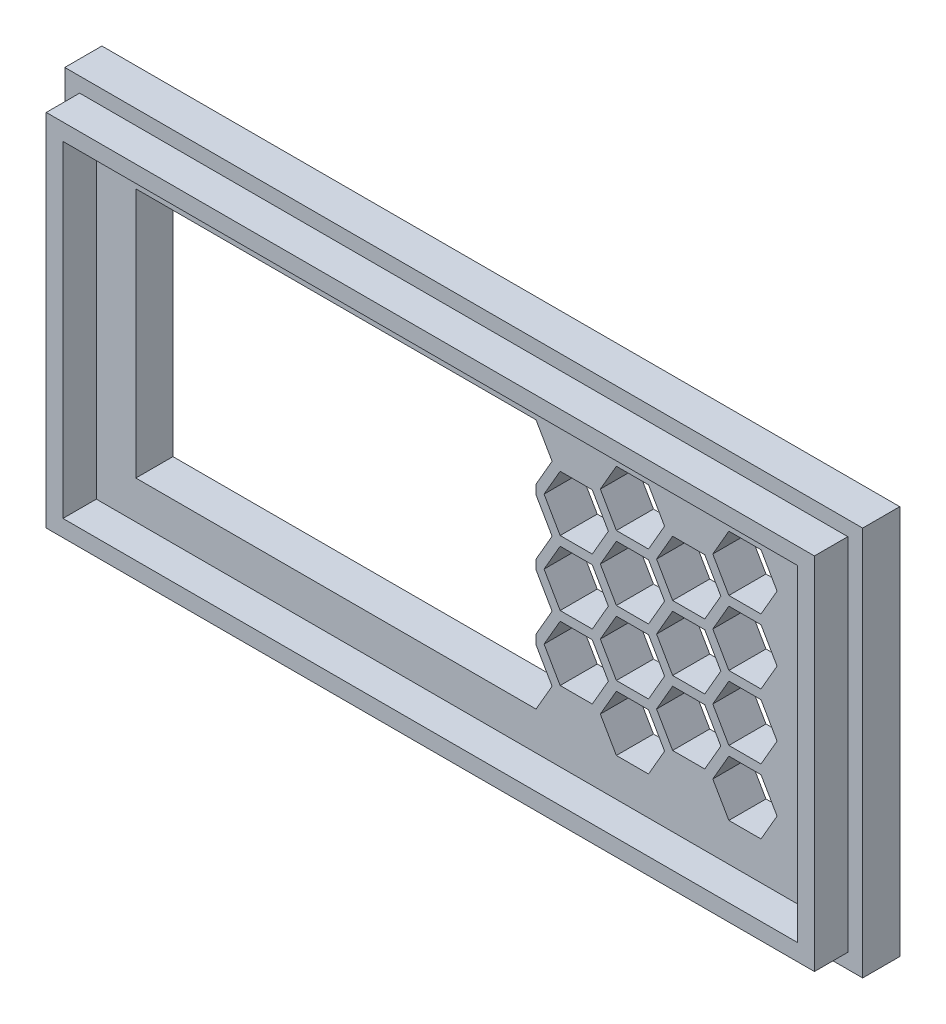
from build123d import *

# Parameters (mm, degrees)
SKETCH1_W           = 43
SKETCH1_H           = 21
BOSS_EXTRUDE1_DEPTH = 2
SKETCH2_W           = 41.4
SKETCH2_H           = 19.4
SKETCH2_W_2         = 39.6
SKETCH2_H_2         = 17.6
BOSS_EXTRUDE2_DEPTH = 1.8
CUT_EXTRUDE1_DEPTH  = 25.010414407
FILL_PATTERN1_DEPTH = 2
SKETCH4_W           = 21.566848352
SKETCH4_H           = 13.5
CUT_EXTRUDE4_DEPTH  = 25.226844615


# Read off the part's stored shape, not the designer's step: Fill Pattern1
with BuildPart() as part:
    # Sketch1 → Boss-Extrude1 (new body)
    with BuildSketch(Plane.XY):
        Rectangle(SKETCH1_W, SKETCH1_H)
    extrude(amount=BOSS_EXTRUDE1_DEPTH)

    # Sketch2 → Boss-Extrude2 (add)
    with BuildSketch(Plane.XY.offset(2)):
        Rectangle(SKETCH2_W, SKETCH2_H)
        Rectangle(SKETCH2_W_2, SKETCH2_H_2, mode=Mode.SUBTRACT)
    extrude(amount=BOSS_EXTRUDE2_DEPTH)

    # Sketch3 → Cut-Extrude1 (cut, through all)
    with BuildSketch(Plane.XY.offset(2)):
        Polygon((-0.866025404, 1.5), (-1.732050808, 0), (-0.866025404, -1.5), (0.866025404, -1.5), (1.732050808, 0), (0.866025404, 1.5), align=None)
    extrude(amount=-CUT_EXTRUDE1_DEPTH, mode=Mode.SUBTRACT)

    # Fill Pattern1 outline → Fill Pattern1 (cut)
    with BuildSketch(Plane.XY):
        Polygon((7.794228634, 0), (6.92820323, 1.5), (5.196152423, 1.5), (4.330127019, 0), (5.196152423, -1.5), (6.92820323, -1.5), align=None)
        Polygon((13.856406461, 0), (12.990381057, 1.5), (11.258330249, 1.5), (10.392304845, 0), (11.258330249, -1.5), (12.990381057, -1.5), align=None)
        Polygon((-4.330127019, 0), (-5.196152423, 1.5), (-6.92820323, 1.5), (-7.794228634, 0), (-6.92820323, -1.5), (-5.196152423, -1.5), align=None)
        Polygon((-10.392304845, 0), (-11.258330249, 1.5), (-12.990381057, 1.5), (-13.856406461, 0), (-12.990381057, -1.5), (-11.258330249, -1.5), align=None)
        Polygon((-2.165063509, 3.75), (-1.299038106, 5.25), (-2.165063509, 6.75), (-3.897114317, 6.75), (-4.763139721, 5.25), (-3.897114317, 3.75), align=None)
        Polygon((3.897114317, -6.75), (4.763139721, -5.25), (3.897114317, -3.75), (2.165063509, -3.75), (1.299038106, -5.25), (2.165063509, -6.75), align=None)
        Polygon((-3.897114317, -6.75), (-2.165063509, -6.75), (-1.299038106, -5.25), (-2.165063509, -3.75), (-3.897114317, -3.75), (-4.763139721, -5.25), align=None)
        Polygon((2.165063509, 3.75), (3.897114317, 3.75), (4.763139721, 5.25), (3.897114317, 6.75), (2.165063509, 6.75), (1.299038106, 5.25), align=None)
        Polygon((16.887495374, -5.25), (16.02146997, -3.75), (14.289419162, -3.75), (13.423393759, -5.25), (14.289419162, -6.75), (16.02146997, -6.75), align=None)
        Polygon((-7.361215932, -5.25), (-8.227241336, -3.75), (-9.959292144, -3.75), (-10.825317547, -5.25), (-9.959292144, -6.75), (-8.227241336, -6.75), align=None)
        Polygon((10.825317547, -5.25), (9.959292144, -3.75), (8.227241336, -3.75), (7.361215932, -5.25), (8.227241336, -6.75), (9.959292144, -6.75), align=None)
        Polygon((-13.423393759, -5.25), (-14.289419162, -3.75), (-16.02146997, -3.75), (-16.887495374, -5.25), (-16.02146997, -6.75), (-14.289419162, -6.75), align=None)
        Polygon((9.959292144, 3.75), (10.825317547, 5.25), (9.959292144, 6.75), (8.227241336, 6.75), (7.361215932, 5.25), (8.227241336, 3.75), align=None)
        Polygon((-10.392304845, 3.5), (-11.258330249, 5), (-12.990381057, 5), (-13.856406461, 3.5), (-12.990381057, 2), (-11.258330249, 2), align=None)
        Polygon((13.856406461, 3.5), (12.990381057, 5), (11.258330249, 5), (10.392304845, 3.5), (11.258330249, 2), (12.990381057, 2), align=None)
        Polygon((1.732050808, 3.5), (0.866025404, 5), (-0.866025404, 5), (-1.732050808, 3.5), (-0.866025404, 2), (0.866025404, 2), align=None)
        Polygon((-4.330127019, 3.5), (-5.196152423, 5), (-6.92820323, 5), (-7.794228634, 3.5), (-6.92820323, 2), (-5.196152423, 2), align=None)
        Polygon((7.794228634, 3.5), (6.92820323, 5), (5.196152423, 5), (4.330127019, 3.5), (5.196152423, 2), (6.92820323, 2), align=None)
        Polygon((-8.227241336, -3.25), (-7.361215932, -1.75), (-8.227241336, -0.25), (-9.959292144, -0.25), (-10.825317547, -1.75), (-9.959292144, -3.25), align=None)
        Polygon((-16.02146997, -3.25), (-14.289419162, -3.25), (-13.423393759, -1.75), (-14.289419162, -0.25), (-16.02146997, -0.25), (-16.887495374, -1.75), align=None)
        Polygon((-7.361215932, 5.25), (-8.227241336, 6.75), (-9.959292144, 6.75), (-10.825317547, 5.25), (-9.959292144, 3.75), (-8.227241336, 3.75), align=None)
        Polygon((-13.423393759, 5.25), (-14.289419162, 6.75), (-16.02146997, 6.75), (-16.887495374, 5.25), (-16.02146997, 3.75), (-14.289419162, 3.75), align=None)
        Polygon((16.887495374, 5.25), (16.02146997, 6.75), (14.289419162, 6.75), (13.423393759, 5.25), (14.289419162, 3.75), (16.02146997, 3.75), align=None)
        Polygon((-13.423393759, 1.75), (-14.289419162, 3.25), (-16.02146997, 3.25), (-16.887495374, 1.75), (-16.02146997, 0.25), (-14.289419162, 0.25), align=None)
        Polygon((10.825317547, 1.75), (9.959292144, 3.25), (8.227241336, 3.25), (7.361215932, 1.75), (8.227241336, 0.25), (9.959292144, 0.25), align=None)
        Polygon((16.887495374, 1.75), (16.02146997, 3.25), (14.289419162, 3.25), (13.423393759, 1.75), (14.289419162, 0.25), (16.02146997, 0.25), align=None)
        Polygon((-1.299038106, 1.75), (-2.165063509, 3.25), (-3.897114317, 3.25), (-4.763139721, 1.75), (-3.897114317, 0.25), (-2.165063509, 0.25), align=None)
        Polygon((-7.361215932, 1.75), (-8.227241336, 3.25), (-9.959292144, 3.25), (-10.825317547, 1.75), (-9.959292144, 0.25), (-8.227241336, 0.25), align=None)
        Polygon((4.763139721, 1.75), (3.897114317, 3.25), (2.165063509, 3.25), (1.299038106, 1.75), (2.165063509, 0.25), (3.897114317, 0.25), align=None)
        Polygon((-11.258330249, -5), (-10.392304845, -3.5), (-11.258330249, -2), (-12.990381057, -2), (-13.856406461, -3.5), (-12.990381057, -5), align=None)
        Polygon((4.763139721, -1.75), (3.897114317, -0.25), (2.165063509, -0.25), (1.299038106, -1.75), (2.165063509, -3.25), (3.897114317, -3.25), align=None)
        Polygon((16.887495374, -1.75), (16.02146997, -0.25), (14.289419162, -0.25), (13.423393759, -1.75), (14.289419162, -3.25), (16.02146997, -3.25), align=None)
        Polygon((10.825317547, -1.75), (9.959292144, -0.25), (8.227241336, -0.25), (7.361215932, -1.75), (8.227241336, -3.25), (9.959292144, -3.25), align=None)
        Polygon((-1.299038106, -1.75), (-2.165063509, -0.25), (-3.897114317, -0.25), (-4.763139721, -1.75), (-3.897114317, -3.25), (-2.165063509, -3.25), align=None)
        Polygon((1.732050808, -3.5), (0.866025404, -2), (-0.866025404, -2), (-1.732050808, -3.5), (-0.866025404, -5), (0.866025404, -5), align=None)
        Polygon((13.856406461, -3.5), (12.990381057, -2), (11.258330249, -2), (10.392304845, -3.5), (11.258330249, -5), (12.990381057, -5), align=None)
        Polygon((7.794228634, -3.5), (6.92820323, -2), (5.196152423, -2), (4.330127019, -3.5), (5.196152423, -5), (6.92820323, -5), align=None)
        Polygon((-4.330127019, -3.5), (-5.196152423, -2), (-6.92820323, -2), (-7.794228634, -3.5), (-6.92820323, -5), (-5.196152423, -5), align=None)
    extrude(amount=FILL_PATTERN1_DEPTH, mode=Mode.SUBTRACT)

    # Sketch4 → Cut-Extrude4 (cut, through all)
    with BuildSketch(Plane(origin=(0, 0, 0), x_dir=(-1, 0, 0), z_dir=(0, 0, -1))):
        with Locations((6.886309859, 0)):
            Rectangle(SKETCH4_W, SKETCH4_H)
    extrude(amount=-CUT_EXTRUDE4_DEPTH, mode=Mode.SUBTRACT)


solid = part.part
